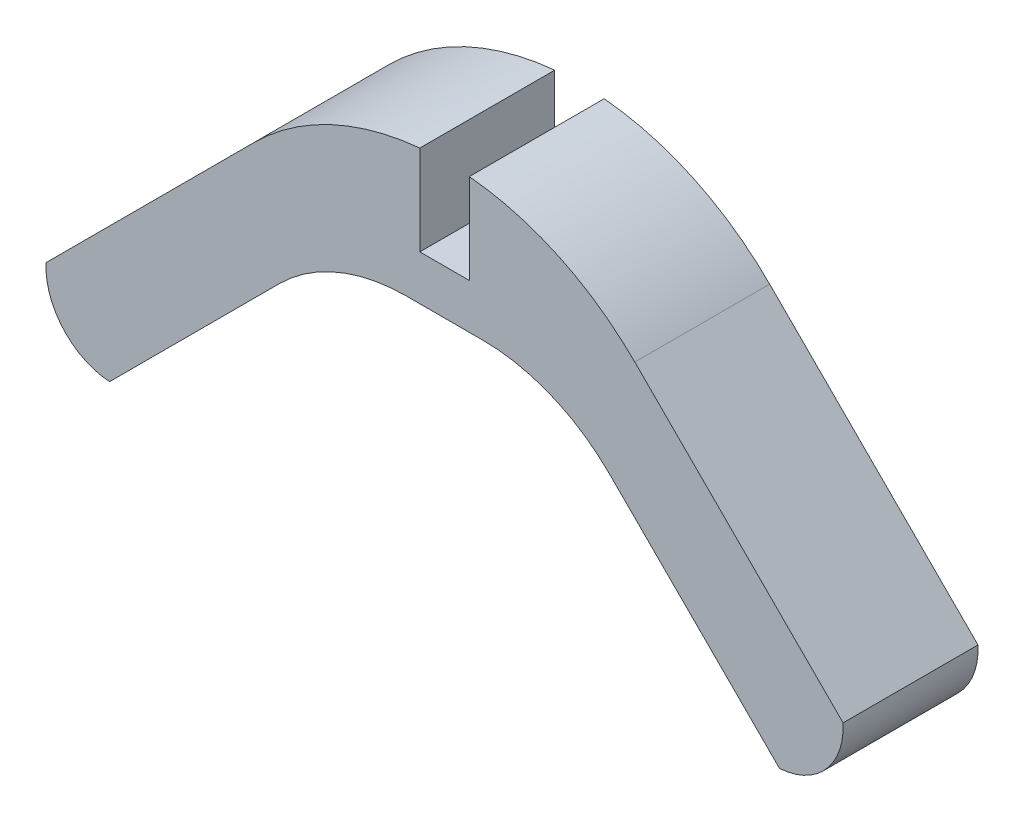
from build123d import *

# Parameters (mm, degrees)
ESTRUSIONE_ESTRUSIONE1_DEPTH = 15
RACCORDO1_R                  = 30
RACCORDO2_R                  = 20


with BuildPart() as part:
    # Schizzo2 → Estrusione-Estrusione1 (new body)
    with BuildSketch(Plane.XY):
        with BuildLine():
            Line((12.5, 0), (-12.5, 0))
            Line((-12.5, 0), (-37.248737342, -24.748737342))
            ThreePointArc((-37.248737342, -24.748737342), (-42.410299766, -22.234372931), (-44.319805153, -16.819805153))
            Line((-44.319805153, -16.819805153), (-12.5, 15))
            Line((-12.5, 15), (-2.75, 15))
            Line((-2.75, 15), (-2.75, 5))
            Line((-2.75, 5), (2.75, 5))
            Line((2.75, 5), (2.75, 15))
            Line((2.75, 15), (12.5, 15))
            Line((12.5, 15), (44.319805153, -16.819805153))
            ThreePointArc((44.319805153, -16.819805153), (42.410299766, -22.234372931), (37.248737342, -24.748737342))
            Line((37.248737342, -24.748737342), (12.5, 0))
        make_face()
    extrude(amount=ESTRUSIONE_ESTRUSIONE1_DEPTH)

    # Raccordo1
    # the kernel refuses this fillet: 30 mm, written as the material it takes off along each edge
    with BuildSketch(Plane(origin=(12.5, 15, -30.600334507), x_dir=(-1, 0, 0), z_dir=(0, 0, 1))) as raccordo1_piece_1:
        with BuildLine():
            CenterArc((12.558121821, 29.86828505), RACCORDO1_R, 225, 39.629019647)
            Line((-8.655081615, 8.655081615), (-9.079345683, 8.230817546))
            Line((-9.079345683, 8.230817546), (-0.424264069, -0.424264069))
            Line((-0.424264069, -0.424264069), (0, -0.6))
            ThreePointArc((0, -0.6), (4.875, -0.6), (9.693837564, -0.597365701))
            Line((9.693837564, -0.597365701), (9.75, 0))
        make_face()
    extrude(amount=76.200669014, mode=Mode.SUBTRACT)
    with BuildSketch(Plane(origin=(-12.5, 15, -30.600334507), x_dir=(-0.7071067811865485, -0.7071067811865467, 0), z_dir=(0, 0, 1))) as raccordo1_piece_2:
        with BuildLine():
            CenterArc((12.240133803, 30), RACCORDO1_R, 230.370980353, 39.629019647)
            Line((-6.894291117, 6.894291117), (-7.276979615, 6.432176939))
            ThreePointArc((-7.276979615, 6.432176939), (-3.871409627, 3.02288149), (-0.424264069, -0.424264069))
            Line((-0.424264069, -0.424264069), (0, -0.6))
            Line((0, -0.6), (12.240133803, -0.6))
            Line((12.240133803, -0.6), (12.240133803, 0))
        make_face()
    extrude(amount=76.200669014, mode=Mode.SUBTRACT)

    # Raccordo2
    raccordo2_edges = [part.edges().sort_by_distance(p)[0] for p in [
        (12.5, 0, 7.5),
        (-12.5, 0, 7.5),
    ]]
    fillet(raccordo2_edges, radius=RACCORDO2_R)


solid = part.part
